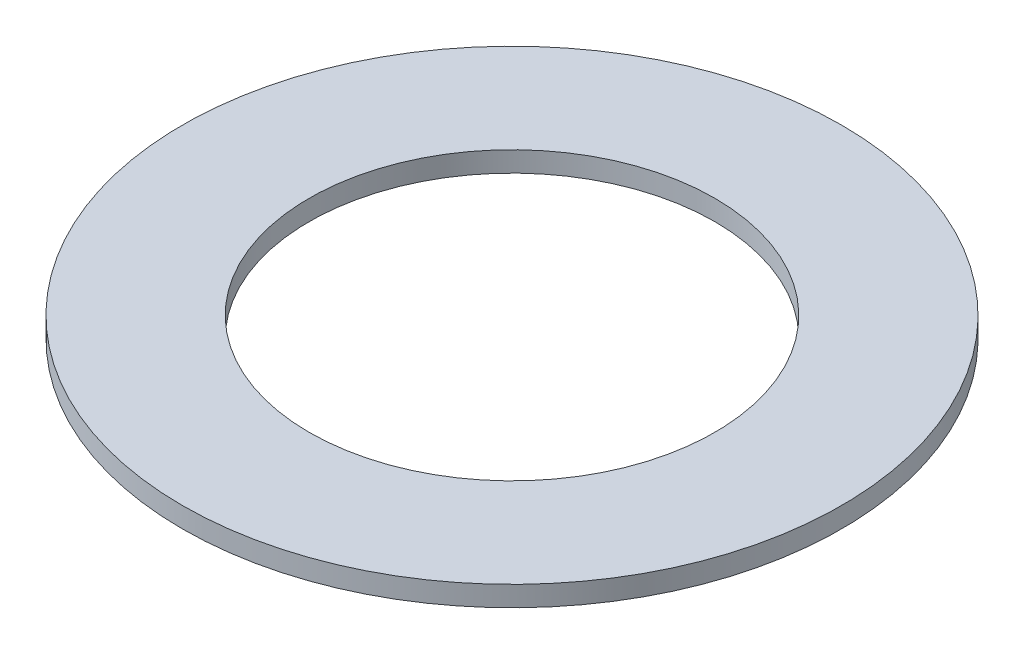
from build123d import *

# Parameters (mm, degrees)
SKETCH1_R           = 65
BOSS_EXTRUDE1_DEPTH = 4
SKETCH2_R           = 40
CUT_EXTRUDE1_DEPTH  = 93.010868923


with BuildPart() as part:
    # Sketch1 → Boss-Extrude1 (new body)
    with BuildSketch(Plane(origin=(0, 0, 0), x_dir=(1, 0, 0), z_dir=(0, 1, 0))):
        Circle(SKETCH1_R)
    extrude(amount=BOSS_EXTRUDE1_DEPTH)

    # Sketch2 → Cut-Extrude1 (cut, through all)
    with BuildSketch(Plane(origin=(0, 0, 0), x_dir=(1, 0, 0), z_dir=(0, 1, 0))):
        Circle(SKETCH2_R)
    extrude(amount=CUT_EXTRUDE1_DEPTH, mode=Mode.SUBTRACT)


solid = part.part
